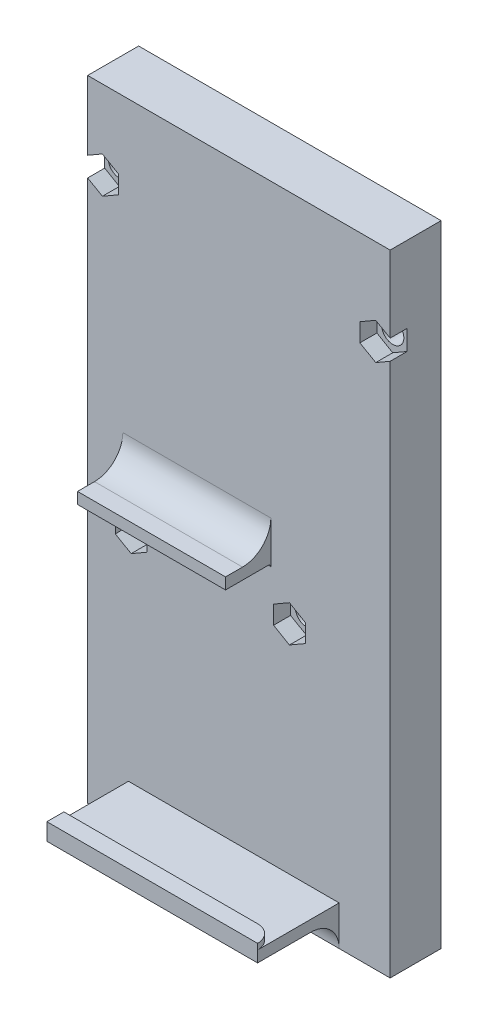
from build123d import *

# Parameters (mm, degrees)
SKETCH2_W           = 53.4
SKETCH2_H           = 104.3
BOSS_EXTRUDE1_DEPTH = 9
SKETCH3_R           = 1.96
CUT_EXTRUDE1_DEPTH  = 60.274889287
SKETCH4_W           = 26.134
SKETCH4_H           = 2
BOSS_EXTRUDE2_DEPTH = 8
FILLET1_R           = 0.5
CUT_EXTRUDE3_DEPTH  = 3
SKETCH8_W           = 53.4
SKETCH8_H           = 9
BOSS_EXTRUDE4_DEPTH = 2
SKETCH9_W           = 37.2
SKETCH9_H           = 1.98
BOSS_EXTRUDE5_DEPTH = 14.4
BOSS_EXTRUDE6_DEPTH = 3
FILLET2_R           = 5
SKETCH13_W          = 53.4
SKETCH13_H          = 9
BOSS_EXTRUDE8_DEPTH = 5
FILLET3_R           = 5


with BuildPart() as part:
    # Sketch2 → Boss-Extrude1 (new body)
    with BuildSketch(Plane.XY):
        Rectangle(SKETCH2_W, SKETCH2_H)
    extrude(amount=BOSS_EXTRUDE1_DEPTH)

    # Sketch3 → Cut-Extrude1 (cut, through all)
    with BuildSketch(Plane(origin=(0, 0, 0), x_dir=(-1, 0, 0), z_dir=(0, 0, -1))):
        with Locations((24.1, 38.21)):
            Circle(SKETCH3_R)
        with Locations((-24.16, 36.91)):
            Circle(SKETCH3_R)
        with Locations((-8.92, -13.89)):
            Circle(SKETCH3_R)
        with Locations((19.02, -13.89)):
            Circle(SKETCH3_R)
    extrude(amount=-CUT_EXTRUDE1_DEPTH, mode=Mode.SUBTRACT)

    # Sketch4 → Boss-Extrude2 (add)
    with BuildSketch(Plane.XY.offset(9)):
        with Locations((-7.427, -5.35)):
            Rectangle(SKETCH4_W, SKETCH4_H)
    extrude(amount=BOSS_EXTRUDE2_DEPTH)

    # Fillet1
    fillet1_edges = [part.edges().sort_by_distance(p)[0] for p in [
        (-7.427, -6.35, 9),
    ]]
    fillet(fillet1_edges, radius=FILLET1_R)

    # Sketch6 → Cut-Extrude3 (cut)
    with BuildSketch(Plane.XY.offset(9)):
        Polygon((-21.3, 36.593419246), (-21.3, 39.826580754), (-24.1, 41.443161507), (-26.9, 39.826580754), (-26.9, 36.593419246), (-24.1, 34.976838493), align=None)
        Polygon((26.96, 35.293419246), (26.96, 38.526580754), (24.16, 40.143161507), (21.36, 38.526580754), (21.36, 35.293419246), (24.16, 33.676838493), align=None)
        Polygon((-16.22, -15.506580754), (-16.22, -12.273419246), (-19.02, -10.656838493), (-21.82, -12.273419246), (-21.82, -15.506580754), (-19.02, -17.123161507), align=None)
        Polygon((11.72, -15.506580754), (11.72, -12.273419246), (8.92, -10.656838493), (6.12, -12.273419246), (6.12, -15.506580754), (8.92, -17.123161507), align=None)
    extrude(amount=-CUT_EXTRUDE3_DEPTH, mode=Mode.SUBTRACT)

    # Sketch8 → Boss-Extrude4 (add)
    with BuildSketch(Plane.XZ.offset(52.15)):
        with Locations((0, 4.5)):
            Rectangle(SKETCH8_W, SKETCH8_H)
    extrude(amount=BOSS_EXTRUDE4_DEPTH)

    # Sketch9 → Boss-Extrude5 (add)
    with BuildSketch(Plane.XY.offset(9)):
        with Locations((-0.9, -53.16)):
            Rectangle(SKETCH9_W, SKETCH9_H)
    extrude(amount=BOSS_EXTRUDE5_DEPTH)

    # Sketch10 → Boss-Extrude6 (add)
    with BuildSketch(Plane.XZ.offset(54.15)):
        with BuildLine():
            Line((14.7, 20.4), (-19.5, 20.4))
            Line((-19.5, 20.4), (-19.5, 23.4))
            Line((-19.5, 23.4), (17.7, 23.4))
            ThreePointArc((17.7, 23.4), (16.821320344, 21.278679656), (14.7, 20.4))
        make_face()
    extrude(amount=-BOSS_EXTRUDE6_DEPTH)

    # Fillet2
    fillet2_edges = [part.edges().sort_by_distance(p)[0] for p in [
        (-7.427, -4.35, 9),
    ]]
    fillet(fillet2_edges, radius=FILLET2_R)

    # Sketch13 → Boss-Extrude8 (add)
    with BuildSketch(Plane.XZ.offset(54.15)):
        with Locations((0, 4.5)):
            Rectangle(SKETCH13_W, SKETCH13_H)
    extrude(amount=BOSS_EXTRUDE8_DEPTH)

    # Fillet3
    fillet3_edges = [part.edges().sort_by_distance(p)[0] for p in [
        (-0.9, -54.15, 9),
    ]]
    fillet(fillet3_edges, radius=FILLET3_R - 0.0001)  # a hair under: the kernel refuses the full size


solid = part.part
